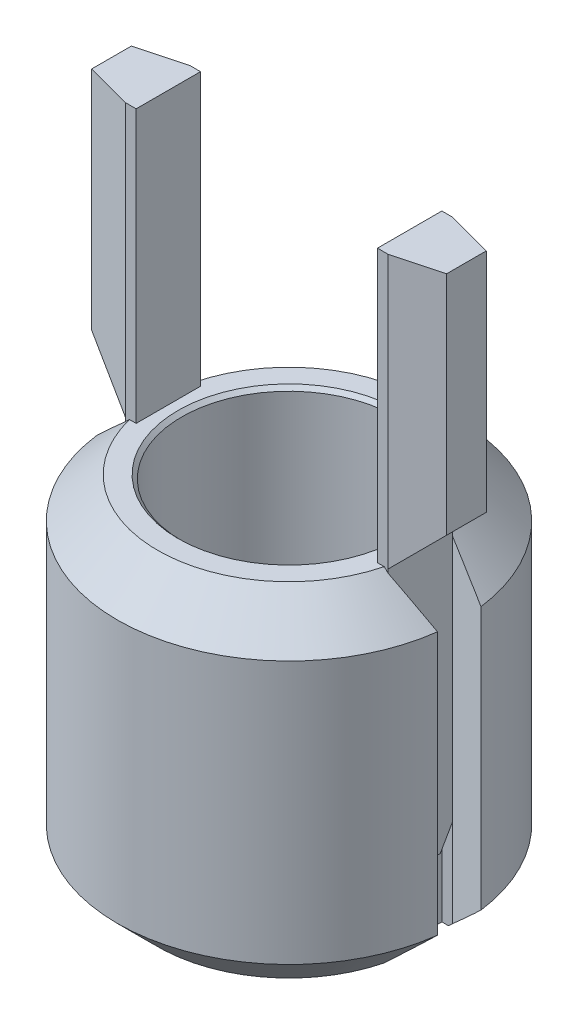
from build123d import *

# Parameters (mm, degrees)
SKETCH3_R           = 4
EXTRUDE1_DEPTH      = 8
CHAMFER1_SIZE       = 0.9375
EXTRUDE2_DEPTH      = 10.797958971
CIRPATTERN1_COUNT   = 2
SKETCH6_R           = 2.5
EXTRUDE3_DEPTH      = 10.784808976
SKETCH12_W          = 0.25
SKETCH12_H          = 1.5
EXTRUDE6_DEPTH      = 6.35
EXTRUDE7_DEPTH      = 6.35
EXTRUDE8_DEPTH      = 10.853975964
EXTRUDE8_DEPTH_BACK = 10.853975964
EXTRUDE9_DEPTH      = 12.376442088
CIRPATTERN2_COUNT   = 2


# Read off the part's stored shape, not the designer's step: Extrude4, Extrude5
with BuildPart() as part:
    # Sketch3 → Extrude1 (new body)
    with BuildSketch(Plane(origin=(0, 0, 0), x_dir=(1, 0, 0), z_dir=(0, 1, 0))):
        with Locations(Location((0, 0, 0), (0, 0, 270))):
            Circle(SKETCH3_R)
    extrude(amount=-EXTRUDE1_DEPTH)

    # Chamfer1
    chamfer1_edges = [part.edges().sort_by_distance(p)[0] for p in [
        (0, 0, -4),
        (0, -8, -4),
    ]]
    chamfer(chamfer1_edges, length=CHAMFER1_SIZE)

    # Sketch11 → Extrude2 (cut, through all)
    with BuildSketch(Plane(origin=(0, 0, 0), x_dir=(1, 0, 0), z_dir=(0, 1, 0))):
        Polygon((-4, 0.498797632), (-3.0625, 0.75), (-2.8125, 0.75), (-2.8125, -0.75), (-3.0625, -0.75), (-4, -0.498797632), align=None)
    extrude2 = extrude(amount=-EXTRUDE2_DEPTH, mode=Mode.SUBTRACT)

    # CirPattern1: Extrude2 ×2 about axis
    cirpattern1_axis = Axis((0, 0, 0), (0, 1, 0))
    for i in range(1, CIRPATTERN1_COUNT):
        add(extrude2.rotate(cirpattern1_axis, i * 360 / CIRPATTERN1_COUNT), mode=Mode.SUBTRACT)

    # Sketch6 → Extrude3 (cut, through all)
    with BuildSketch(Plane(origin=(0, 0, 0), x_dir=(1, 0, 0), z_dir=(0, 1, 0))):
        with Locations(Location((0, 0, 0), (0, 0, 270))):
            Circle(SKETCH6_R)
    extrude(amount=-EXTRUDE3_DEPTH, mode=Mode.SUBTRACT)

    # Extrude4 outline → Extrude4 (revolve, cut)
    with BuildSketch(Plane.XY):
        Polygon((2.5, 0), (2.5, -0.08660254), (2.58660254, 0), align=None)
    revolve(axis=Axis((0, 0, 0), (0, 1, 0)), mode=Mode.SUBTRACT)

    # Extrude5 outline → Extrude5 (revolve, cut)
    with BuildSketch(Plane.XY):
        Polygon((2.58660254, -8), (2.5, -7.91339746), (2.5, -8), align=None)
    revolve(axis=Axis((0, 0, 0), (0, 1, 0)), mode=Mode.SUBTRACT)


with BuildPart() as body_2:
    # Sketch12 → Extrude6 (new, symmetric)
    with BuildSketch(Plane(origin=(0, 0, 0), x_dir=(1, 0, 0), z_dir=(0, 1, 0))):
        with Locations((-2.9375, 0)):
            Rectangle(SKETCH12_W, SKETCH12_H)
    extrude(amount=EXTRUDE6_DEPTH, both=True)

    # Sketch13 → Extrude7 (add)
    with BuildSketch(Plane(origin=(0, 6.35, 0), x_dir=(1, 0, 0), z_dir=(0, 1, 0))):
        Polygon((-4.135316469, 0.462539693), (-3.0625, 0.75), (-3.0625, -0.75), (-4.135316469, -0.462539693), align=None)
    extrude(amount=-EXTRUDE7_DEPTH)

    # Sketch14 → Extrude8 (cut, two sides: drawn at the far end of the back side and taken through both)
    with BuildSketch(Plane.XY.offset(-EXTRUDE8_DEPTH_BACK)):
        Polygon((-4.135316469, 0), (-4.135316469, 1.072816469), (-3.0625, 0), align=None)
    extrude(amount=EXTRUDE8_DEPTH + EXTRUDE8_DEPTH_BACK, mode=Mode.SUBTRACT)

    # Sketch15 → Extrude9 (cut, through all)
    with BuildSketch(Plane.ZY.offset(3.0625)):
        Polygon((-0.462539693, -6.35), (-0.75, -5.852104144), (-0.75, -6.35), align=None)
        Polygon((0.462539693, -6.35), (0.75, -6.35), (0.75, -5.852104144), align=None)
    extrude(amount=-EXTRUDE9_DEPTH, mode=Mode.SUBTRACT)


with BuildPart() as cirpattern2_1:
    # CirPattern2: pattern copy
    add(body_2.part.rotate(Axis((0, 0, 0), (0, 1, 0)), 1 * 360 / CIRPATTERN2_COUNT))


solid = Compound([part.part, body_2.part, cirpattern2_1.part])
